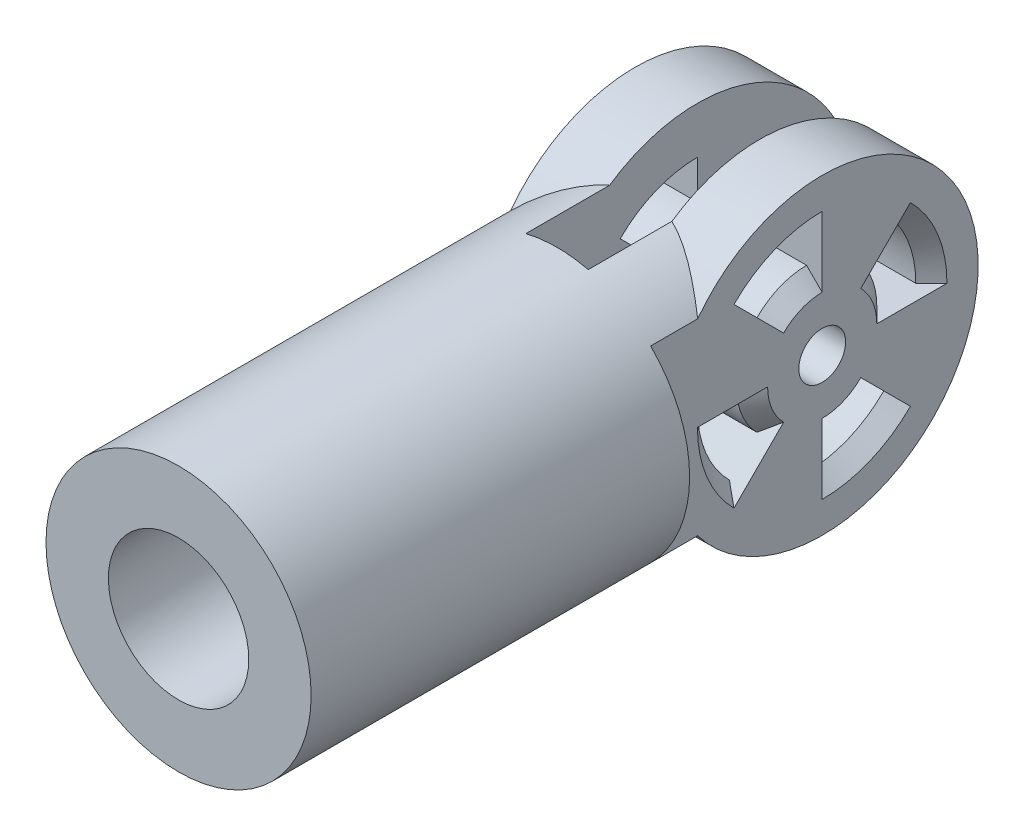
from build123d import *

# Parameters (mm, degrees)
SKETCH1_R           = 8.5
SKETCH1_R_2         = 4.5
BOSS_EXTRUDE1_DEPTH = 30
SKETCH2_R           = 10
BOSS_EXTRUDE2_DEPTH = 6
SKETCH4_R           = 1.5
CUT_EXTRUDE1_DEPTH  = 17
SKETCH5_W           = 22
SKETCH5_H           = 22
CUT_EXTRUDE2_DEPTH  = 2
SKETCH6_W           = 22
SKETCH6_H           = 22
CUT_EXTRUDE3_DEPTH  = 10
SKETCH7_W           = 22
SKETCH7_H           = 22
CUT_EXTRUDE4_DEPTH  = 11
CUT_EXTRUDE5_DEPTH  = 12
CHAMFER1_SIZE       = 1


with BuildPart() as part:
    # Sketch1 → Boss-Extrude1 (new body)
    with BuildSketch(Plane.XY):
        Circle(SKETCH1_R)
        Circle(SKETCH1_R_2, mode=Mode.SUBTRACT)
    extrude(amount=BOSS_EXTRUDE1_DEPTH)

    # Sketch2 → Boss-Extrude2 (add, symmetric)
    with BuildSketch(Plane(origin=(0, 0, 0), x_dir=(0, 0, -1), z_dir=(1, 0, 0))):
        with Locations((5.267826876, 0)):
            Circle(SKETCH2_R)
    extrude(amount=BOSS_EXTRUDE2_DEPTH, both=True)

    # Sketch4 → Cut-Extrude1 (cut, symmetric)
    with BuildSketch(Plane.ZY.offset(6)):
        with Locations((-5.267826876, 0)):
            Circle(SKETCH4_R)
    extrude(amount=CUT_EXTRUDE1_DEPTH, both=True, mode=Mode.SUBTRACT)

    # Sketch5 → Cut-Extrude2 (cut, symmetric)
    with BuildSketch(Plane(origin=(0, 0, 0), x_dir=(0, 0, -1), z_dir=(1, 0, 0))):
        with Locations((5.267826876, 0)):
            Rectangle(SKETCH5_W, SKETCH5_H)
    extrude(amount=CUT_EXTRUDE2_DEPTH, both=True, mode=Mode.SUBTRACT)

    # Sketch6 → Cut-Extrude3 (cut)
    with BuildSketch(Plane.ZY.offset(6)):
        with Locations((-5.267826876, 0)):
            Rectangle(SKETCH6_W, SKETCH6_H)
    extrude(amount=CUT_EXTRUDE3_DEPTH, mode=Mode.SUBTRACT)

    # Sketch7 → Cut-Extrude4 (cut)
    with BuildSketch(Plane(origin=(6, 0, 0), x_dir=(0, 0, -1), z_dir=(1, 0, 0))):
        with Locations((5.267826876, 0)):
            Rectangle(SKETCH7_W, SKETCH7_H)
    extrude(amount=CUT_EXTRUDE4_DEPTH, mode=Mode.SUBTRACT)

    # Sketch8 → Cut-Extrude5 (cut)
    with BuildSketch(Plane(origin=(6, 0, 0), x_dir=(0, 0, -1), z_dir=(1, 0, 0))):
        with BuildLine():
            ThreePointArc((8.449807392, 3.181980515), (9.425284773, 1.722075446), (9.767826876, 0))
            Line((9.767826876, 0), (12.267826876, 0))
            ThreePointArc((12.267826876, 0), (11.734983604, 2.678784027), (10.217574345, 4.949747468))
            Line((10.217574345, 4.949747468), (8.449807392, 3.181980515))
        make_face()
        with BuildLine():
            Line((10.217574345, -4.949747468), (8.449807392, -3.181980515))
            ThreePointArc((8.449807392, -3.181980515), (6.989902322, -4.157457896), (5.267826876, -4.5))
            Line((5.267826876, -4.5), (5.267826876, -7))
            ThreePointArc((5.267826876, -7), (7.946610903, -6.467156728), (10.217574345, -4.949747468))
        make_face()
        with BuildLine():
            ThreePointArc((2.085846361, 3.181980515), (3.545751431, 4.157457896), (5.267826876, 4.5))
            Line((5.267826876, 4.5), (5.267826876, 7))
            ThreePointArc((5.267826876, 7), (2.58904285, 6.467156728), (0.318079408, 4.949747468))
            Line((0.318079408, 4.949747468), (2.085846361, 3.181980515))
        make_face()
        with BuildLine():
            ThreePointArc((2.085846361, -3.181980515), (1.11036898, -1.722075446), (0.767826876, 0))
            Line((0.767826876, 0), (-1.732173124, 0))
            ThreePointArc((-1.732173124, 0), (-1.199329851, -2.678784027), (0.318079408, -4.949747468))
            Line((0.318079408, -4.949747468), (2.085846361, -3.181980515))
        make_face()
    extrude(amount=-CUT_EXTRUDE5_DEPTH, mode=Mode.SUBTRACT)

    # Chamfer1
    chamfer1_edges = [part.edges().sort_by_distance(p)[0] for p in [
        (6, -2.678784027, 1.199329851),
        (6, -6.467156728, -7.946610903),
        (6, 2.678784027, -11.734983604),
        (6, 6.467156728, -2.58904285),
        (-6, 6.467156728, -2.58904285),
        (-6, 2.678784027, -11.734983604),
        (-6, -6.467156728, -7.946610903),
        (-6, -2.678784027, 1.199329851),
        (-6, -1.722075446, -1.11036898),
        (-6, -4.157457896, -6.989902322),
        (-6, 1.722075446, -9.425284773),
        (-6, 4.157457896, -3.545751431),
        (6, 4.157457896, -3.545751431),
        (6, -1.722075446, -1.11036898),
        (6, -4.157457896, -6.989902322),
        (6, 1.722075446, -9.425284773),
    ]]
    chamfer(chamfer1_edges, length=CHAMFER1_SIZE)


solid = part.part
